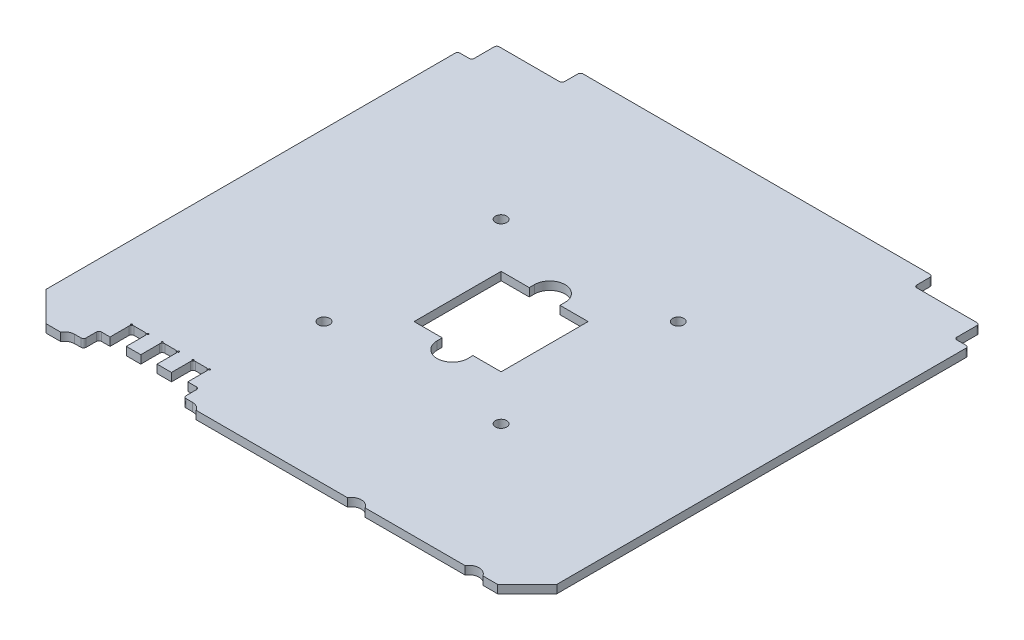
from build123d import *

# Parameters (mm, degrees)
GENERICCARDPCBDEFINITION_FILLET3_START   = -0.8
GENERICCARDPCBDEFINITION_FILLET3_OUTLI_R = 0.16
GENERICCARDPCBDEFINITION_FILLET3_DEPTH   = 1.6
SKETCH1_R                                = 1.1
CUT_EXTRUDE1_DEPTH                       = 10


# Read off the part's stored shape, not the designer's step: <GenericCardPCBDefinition>-<Fillet3>
with BuildPart() as part:
    # <GenericCardPCBDefinition>-<Fillet3> outli → <GenericCardPCBDefinition>-<Fillet3> (new body)
    with BuildSketch(Plane(origin=(0, 0, 0), x_dir=(1, 0, 0), z_dir=(0, 1, 0)).offset(GENERICCARDPCBDEFINITION_FILLET3_START)):
        with BuildLine():
            ThreePointArc((-41.232050808, -44.8), (-40.5, -44.067949192), (-39.5, -43.8))
            Line((-39.5, -43.8), (-38.267949192, -43.8))
            ThreePointArc((-38.267949192, -43.8), (-37.914395801, -43.653553391), (-37.767949192, -43.3))
            Line((-37.767949192, -43.3), (-37.767949192, -41.3))
            ThreePointArc((-37.767949192, -41.3), (-37.621502583, -40.946446609), (-37.267949192, -40.8))
            Line((-37.267949192, -40.8), (-35.59, -40.8))
            Line((-35.59, -40.8), (-35.59, -37.1))
            ThreePointArc((-35.59, -37.1), (-35.443553391, -36.746446609), (-35.09, -36.6))
            Line((-35.09, -36.6), (-32.91, -36.6))
            ThreePointArc((-32.91, -36.6), (-32.556446609, -36.746446609), (-32.41, -37.1))
            Line((-32.41, -37.1), (-32.41, -40.8))
            Line((-32.41, -40.8), (-29.59, -40.8))
            Line((-29.59, -40.8), (-29.59, -37.1))
            ThreePointArc((-29.59, -37.1), (-29.443553391, -36.746446609), (-29.09, -36.6))
            Line((-29.09, -36.6), (-26.91, -36.6))
            ThreePointArc((-26.91, -36.6), (-26.556446609, -36.746446609), (-26.41, -37.1))
            Line((-26.41, -37.1), (-26.41, -40.8))
            Line((-26.41, -40.8), (-23.59, -40.8))
            Line((-23.59, -40.8), (-23.59, -37.1))
            ThreePointArc((-23.59, -37.1), (-23.443553391, -36.746446609), (-23.09, -36.6))
            Line((-23.09, -36.6), (-20.91, -36.6))
            ThreePointArc((-20.91, -36.6), (-20.556446609, -36.746446609), (-20.41, -37.1))
            Line((-20.41, -37.1), (-20.41, -40.8))
            Line((-20.41, -40.8), (-18.732050808, -40.8))
            ThreePointArc((-18.732050808, -40.8), (-18.378497417, -40.946446609), (-18.232050808, -41.3))
            Line((-18.232050808, -41.3), (-18.232050808, -43.3))
            ThreePointArc((-18.232050808, -43.3), (-18.085604199, -43.653553391), (-17.732050808, -43.8))
            Line((-17.732050808, -43.8), (-16.5, -43.8))
            ThreePointArc((-16.5, -43.8), (-15.5, -44.067949192), (-14.767949192, -44.8))
            Line((-14.767949192, -44.8), (14.767949192, -44.8))
            ThreePointArc((14.767949192, -44.8), (16.5, -43.8), (18.232050808, -44.8))
            Line((18.232050808, -44.8), (37.767949192, -44.8))
            ThreePointArc((37.767949192, -44.8), (39.5, -43.8), (41.232050808, -44.8))
            Line((41.232050808, -44.8), (44.1, -44.8))
            Line((44.1, -44.8), (49.9, -39))
            Line((49.9, -39), (49.9, 40.9))
            ThreePointArc((49.9, 40.9), (49.753553391, 41.253553391), (49.4, 41.4))
            Line((49.4, 41.4), (47.65, 41.4))
            ThreePointArc((47.65, 41.4), (47.296446609, 41.546446609), (47.15, 41.9))
            Line((47.15, 41.9), (47.15, 45.8))
            ThreePointArc((47.15, 45.8), (47.003553391, 46.153553391), (46.65, 46.3))
            Line((46.65, 46.3), (34.9, 46.3))
            ThreePointArc((34.9, 46.3), (34.546446609, 46.446446609), (34.4, 46.8))
            Line((34.4, 46.8), (34.4, 49.4))
            ThreePointArc((34.4, 49.4), (34.253553391, 49.753553391), (33.9, 49.9))
            Line((33.9, 49.9), (-33.9, 49.9))
            ThreePointArc((-33.9, 49.9), (-34.253553391, 49.753553391), (-34.4, 49.4))
            Line((-34.4, 49.4), (-34.4, 46.8))
            ThreePointArc((-34.4, 46.8), (-34.546446609, 46.446446609), (-34.9, 46.3))
            Line((-34.9, 46.3), (-46.65, 46.3))
            ThreePointArc((-46.65, 46.3), (-47.003553391, 46.153553391), (-47.15, 45.8))
            Line((-47.15, 45.8), (-47.15, 41.9))
            ThreePointArc((-47.15, 41.9), (-47.296446609, 41.546446609), (-47.65, 41.4))
            Line((-47.65, 41.4), (-49.4, 41.4))
            ThreePointArc((-49.4, 41.4), (-49.753553391, 41.253553391), (-49.9, 40.9))
            Line((-49.9, 40.9), (-49.9, -39))
            Line((-49.9, -39), (-44.1, -44.8))
            Line((-44.1, -44.8), (-41.232050808, -44.8))
        make_face()
        with Locations((-35.59, -36.6)):
            Circle(GENERICCARDPCBDEFINITION_FILLET3_OUTLI_R, mode=Mode.SUBTRACT)
        with Locations((-32.41, -36.6)):
            Circle(GENERICCARDPCBDEFINITION_FILLET3_OUTLI_R, mode=Mode.SUBTRACT)
        with Locations((-29.59, -36.6)):
            Circle(GENERICCARDPCBDEFINITION_FILLET3_OUTLI_R, mode=Mode.SUBTRACT)
        with Locations((-26.41, -36.6)):
            Circle(GENERICCARDPCBDEFINITION_FILLET3_OUTLI_R, mode=Mode.SUBTRACT)
        with Locations((-23.59, -36.6)):
            Circle(GENERICCARDPCBDEFINITION_FILLET3_OUTLI_R, mode=Mode.SUBTRACT)
        with Locations((-20.41, -36.6)):
            Circle(GENERICCARDPCBDEFINITION_FILLET3_OUTLI_R, mode=Mode.SUBTRACT)
    extrude(amount=GENERICCARDPCBDEFINITION_FILLET3_DEPTH)

    # Sketch1 → Cut-Extrude1 (cut)
    with BuildSketch(Plane(origin=(0, 0.8, 0), x_dir=(1, 0, 0), z_dir=(0, 1, 0))):
        with Locations(Location((-17.3, -17.3, 0), (0, 0, 270))):
            Circle(SKETCH1_R)
        with Locations(Location((17.3, -17.3, 0), (0, 0, 270))):
            Circle(SKETCH1_R)
        with Locations(Location((-17.3, 17.3, 0), (0, 0, 270))):
            Circle(SKETCH1_R)
        with Locations(Location((17.3, 17.3, 0), (0, 0, 270))):
            Circle(SKETCH1_R)
        with BuildLine():
            Line((8.5, -8.5), (8.5, 8.5))
            Line((8.5, 8.5), (3, 8.5))
            Line((3, 8.5), (3, 9.5))
            ThreePointArc((3, 9.5), (0, 12.5), (-3, 9.5))
            Line((-3, 9.5), (-3, 8.5))
            Line((-3, 8.5), (-8.5, 8.5))
            Line((-8.5, 8.5), (-8.5, -8.5))
            Line((-8.5, -8.5), (-3, -8.5))
            Line((-3, -8.5), (-3, -9.5))
            ThreePointArc((-3, -9.5), (0, -12.5), (3, -9.5))
            Line((3, -9.5), (3, -8.5))
            Line((3, -8.5), (8.5, -8.5))
        make_face()
    extrude(amount=-CUT_EXTRUDE1_DEPTH, mode=Mode.SUBTRACT)


solid = part.part
